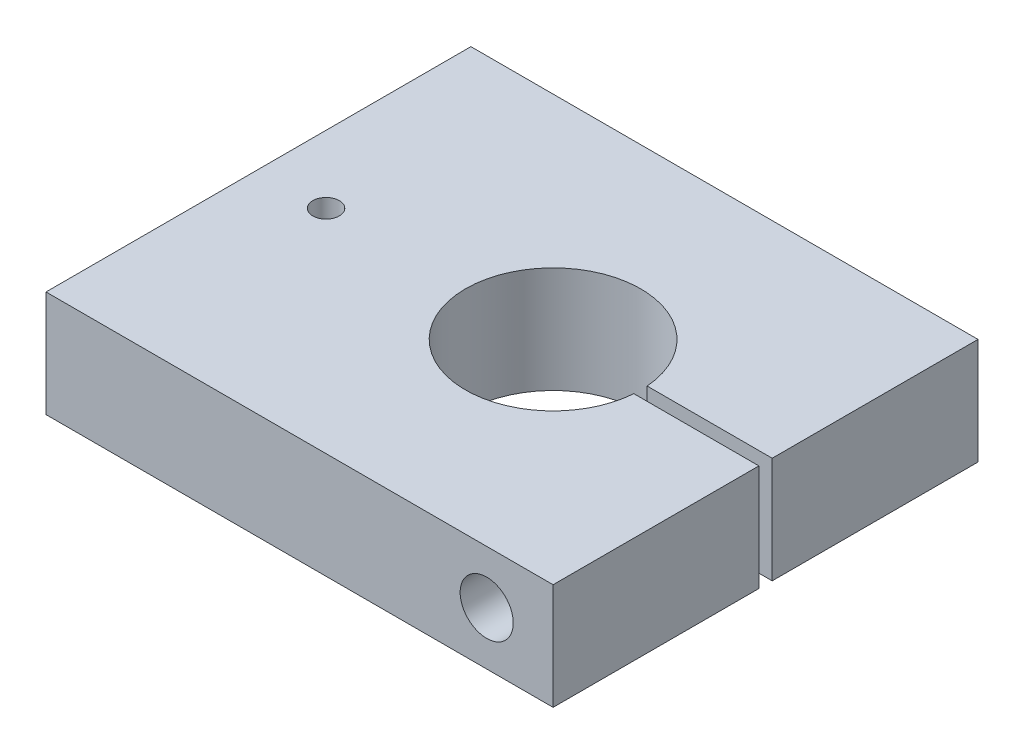
from build123d import *

# Parameters (mm, degrees)
SKETCH1_W           = 121.249023843
SKETCH1_H           = 101.6
SKETCH1_R           = 20.955
SKETCH1_R_2         = 3.175
BOSS_EXTRUDE1_DEPTH = 25.4
SKETCH2_R           = 6.35
CUT_EXTRUDE1_DEPTH  = 229.6
SKETCH3_W           = 31.554427073
SKETCH3_H           = 3.175
CUT_EXTRUDE2_DEPTH  = 229.6


with BuildPart() as part:
    # Sketch1 → Boss-Extrude1 (new body)
    with BuildSketch(Plane(origin=(0, 0, 0), x_dir=(1, 0, 0), z_dir=(0, 1, 0))):
        with Locations((142.575488079, 50.8)):
            Rectangle(SKETCH1_W, SKETCH1_H)
        with Locations((152.4, 50.8)):
            Circle(SKETCH1_R, mode=Mode.SUBTRACT)
        with Locations((98.1075, 50.8)):
            Circle(SKETCH1_R_2, mode=Mode.SUBTRACT)
    extrude(amount=BOSS_EXTRUDE1_DEPTH)

    # Sketch2 → Cut-Extrude1 (cut, through all)
    with BuildSketch(Plane.XY):
        with Locations((187.325, 12.7)):
            Circle(SKETCH2_R)
    extrude(amount=-CUT_EXTRUDE1_DEPTH, mode=Mode.SUBTRACT)

    # Sketch3 → Cut-Extrude2 (cut, through all)
    with BuildSketch(Plane(origin=(0, 25.4, 0), x_dir=(1, 0, 0), z_dir=(0, 1, 0))):
        with Locations((187.422786464, 50.8)):
            Rectangle(SKETCH3_W, SKETCH3_H)
    extrude(amount=-CUT_EXTRUDE2_DEPTH, mode=Mode.SUBTRACT)


solid = part.part
